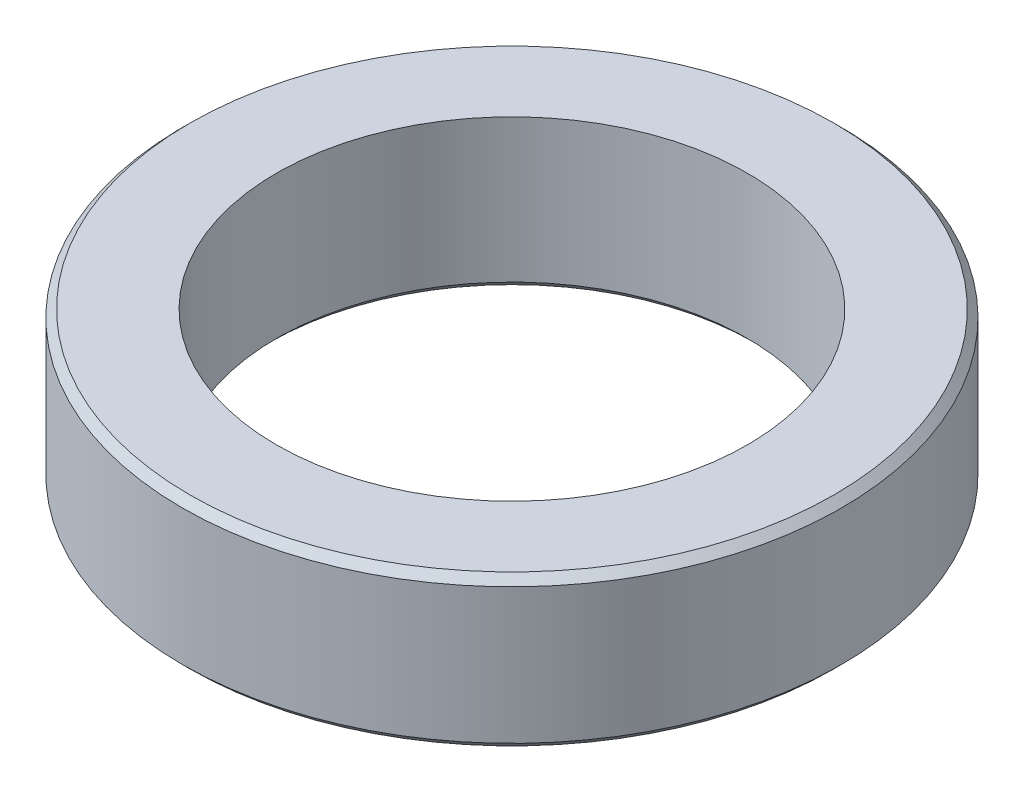
from build123d import *

# Parameters (mm, degrees)
SKETCH1_R           = 111.125
SKETCH1_R_2         = 79.375
BOSS_EXTRUDE1_DEPTH = 50.8
CHAMFER1_SIZE       = 2.54


with BuildPart() as part:
    # Sketch1 → Boss-Extrude1 (new body)
    with BuildSketch(Plane(origin=(0, 0, 0), x_dir=(1, 0, 0), z_dir=(0, 1, 0))):
        Circle(SKETCH1_R)
        Circle(SKETCH1_R_2, mode=Mode.SUBTRACT)
    extrude(amount=BOSS_EXTRUDE1_DEPTH)

    # Chamfer1
    chamfer1_edges = [part.edges().sort_by_distance(p)[0] for p in [
        (-111.125, 50.8, 0),
        (-111.125, 0, 0),
        (-79.375, 0, 0),
    ]]
    chamfer(chamfer1_edges, length=CHAMFER1_SIZE)


solid = part.part
